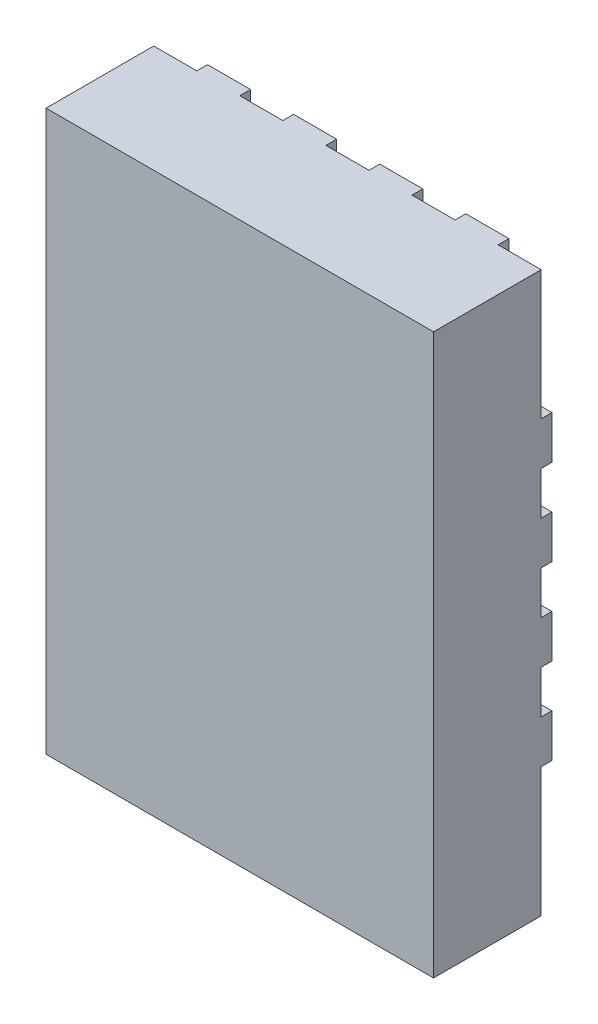
from build123d import *

# Parameters (mm, degrees)
BOSS_EXTRUDE1_START    = 0.05
SKETCH1_W              = 1.8
SKETCH1_H              = 2.6
BOSS_EXTRUDE1_DEPTH    = 0.5
BOSS_EXTRUDE2_DEPTH    = 0.15
BOSS_EXTRUDE3_DEPTH    = 0.15
BOSS_EXTRUDE4_DEPTH    = 0.15
LPATTERN5_COPY_1_DEPTH = 0.15
LPATTERN5_COPY_2_DEPTH = 0.15
LPATTERN6_COUNT        = 4
LPATTERN6_PITCH        = 0.4
LPATTERN6_COPY_1_DEPTH = 0.15
LPATTERN6_COPY_2_DEPTH = 0.15
LPATTERN6_COPY_3_DEPTH = 0.15
LPATTERN7_DEPTH        = 0.05


# Read off the part's stored shape, not the designer's step: LPattern7
with BuildPart() as part:
    # Sketch1 → Boss-Extrude1 (new body)
    with BuildSketch(Plane.XY.offset(BOSS_EXTRUDE1_START)):
        Rectangle(SKETCH1_W, SKETCH1_H)
    extrude(amount=BOSS_EXTRUDE1_DEPTH)

    # Sketch2 → Boss-Extrude2 (add)
    with BuildSketch(Plane.XY):
        with BuildLine():
            Line((-0.9, 0.7), (-0.5, 0.7))
            ThreePointArc((-0.5, 0.7), (-0.4, 0.6), (-0.5, 0.5))
            Line((-0.5, 0.5), (-0.9, 0.5))
            Line((-0.9, 0.5), (-0.9, 0.7))
        make_face()
    extrude(amount=BOSS_EXTRUDE2_DEPTH)

    # Sketch3 → Boss-Extrude3 (add)
    with BuildSketch(Plane.XY):
        with BuildLine():
            Line((-0.7, 1.3), (-0.7, 1))
            ThreePointArc((-0.7, 1), (-0.6, 0.9), (-0.5, 1))
            Line((-0.5, 1), (-0.5, 1.3))
            Line((-0.5, 1.3), (-0.7, 1.3))
        make_face()
    boss_extrude3 = extrude(amount=BOSS_EXTRUDE3_DEPTH)

    # Sketch3<3> → Boss-Extrude4 (add)
    with BuildSketch(Plane.XY):
        with BuildLine():
            Line((-0.9, 0.1), (-0.6, 0.1))
            ThreePointArc((-0.6, 0.1), (-0.5, 0.2), (-0.6, 0.3))
            Line((-0.6, 0.3), (-0.9, 0.3))
            Line((-0.9, 0.3), (-0.9, 0.1))
        make_face()
    boss_extrude4 = extrude(amount=BOSS_EXTRUDE4_DEPTH)

    # Mirror8: Boss-Extrude4 across plane
    add(boss_extrude4.mirror(Plane(origin=(0, 0, 0), x_dir=(0, 0, 1), z_dir=(1, 0, 0))))

    # Mirror9: Boss-Extrude3 across plane
    add(boss_extrude3.mirror(Plane.ZX))

    # LPattern5 copy 1 sketch → LPattern5 copy 1 (add)
    with BuildSketch(Plane(origin=(0, 0.4, 0), x_dir=(-1, 0, 0), z_dir=(0, 0, 1))):
        with BuildLine():
            Line((-0.9, -0.1), (-0.6, -0.1))
            ThreePointArc((-0.6, -0.1), (-0.5, -0.2), (-0.6, -0.3))
            Line((-0.6, -0.3), (-0.9, -0.3))
            Line((-0.9, -0.3), (-0.9, -0.1))
        make_face()
    extrude(amount=LPATTERN5_COPY_1_DEPTH)

    # LPattern5 copy 2 sketch → LPattern5 copy 2 (add)
    with BuildSketch(Plane(origin=(0, 0.4, 0), x_dir=(1, 0, 0), z_dir=(0, 0, 1))):
        with BuildLine():
            Line((-0.9, 0.1), (-0.6, 0.1))
            ThreePointArc((-0.6, 0.1), (-0.5, 0.2), (-0.6, 0.3))
            Line((-0.6, 0.3), (-0.9, 0.3))
            Line((-0.9, 0.3), (-0.9, 0.1))
        make_face()
    extrude(amount=LPATTERN5_COPY_2_DEPTH)

    # LPattern6: Boss-Extrude3 ×4
    with Locations(*[(i * LPATTERN6_PITCH, 0, 0) for i in range(1, LPATTERN6_COUNT)]):
        add(boss_extrude3)

    # LPattern6 copy 1 sketch → LPattern6 copy 1 (add)
    with BuildSketch(Plane(origin=(0.4, 0, 0), x_dir=(1, 0, 0), z_dir=(0, 0, 1))):
        with BuildLine():
            Line((-0.7, -1.3), (-0.7, -1))
            ThreePointArc((-0.7, -1), (-0.6, -0.9), (-0.5, -1))
            Line((-0.5, -1), (-0.5, -1.3))
            Line((-0.5, -1.3), (-0.7, -1.3))
        make_face()
    extrude(amount=LPATTERN6_COPY_1_DEPTH)

    # LPattern6 copy 2 sketch → LPattern6 copy 2 (add)
    with BuildSketch(Plane(origin=(0.8, 0, 0), x_dir=(1, 0, 0), z_dir=(0, 0, 1))):
        with BuildLine():
            Line((-0.7, -1.3), (-0.7, -1))
            ThreePointArc((-0.7, -1), (-0.6, -0.9), (-0.5, -1))
            Line((-0.5, -1), (-0.5, -1.3))
            Line((-0.5, -1.3), (-0.7, -1.3))
        make_face()
    extrude(amount=LPATTERN6_COPY_2_DEPTH)

    # LPattern6 copy 3 sketch → LPattern6 copy 3 (add)
    with BuildSketch(Plane(origin=(1.2, 0, 0), x_dir=(1, 0, 0), z_dir=(0, 0, 1))):
        with BuildLine():
            Line((-0.7, -1.3), (-0.7, -1))
            ThreePointArc((-0.7, -1), (-0.6, -0.9), (-0.5, -1))
            Line((-0.5, -1), (-0.5, -1.3))
            Line((-0.5, -1.3), (-0.7, -1.3))
        make_face()
    extrude(amount=LPATTERN6_COPY_3_DEPTH)

    # LPattern7 outline → LPattern7 (add)
    with BuildSketch(Plane.XY):
        with BuildLine():
            ThreePointArc((0.6, -0.1), (0.5, -0.2), (0.6, -0.3))
            Line((0.6, -0.3), (0.9, -0.3))
            Line((0.9, -0.3), (0.9, -0.1))
            Line((0.9, -0.1), (0.6, -0.1))
        make_face()
        with BuildLine():
            Line((0.9, -0.7), (0.9, -0.5))
            Line((0.9, -0.5), (0.6, -0.5))
            ThreePointArc((0.6, -0.5), (0.5, -0.6), (0.6, -0.7))
            Line((0.6, -0.7), (0.9, -0.7))
        make_face()
        with BuildLine():
            Line((-0.6, -0.5), (-0.9, -0.5))
            Line((-0.9, -0.5), (-0.9, -0.7))
            Line((-0.9, -0.7), (-0.6, -0.7))
            ThreePointArc((-0.6, -0.7), (-0.5, -0.6), (-0.6, -0.5))
        make_face()
        with BuildLine():
            Line((-0.9, -0.3), (-0.6, -0.3))
            ThreePointArc((-0.6, -0.3), (-0.5, -0.2), (-0.6, -0.1))
            Line((-0.6, -0.1), (-0.9, -0.1))
            Line((-0.9, -0.1), (-0.9, -0.3))
        make_face()
    extrude(amount=LPATTERN7_DEPTH)


solid = part.part
